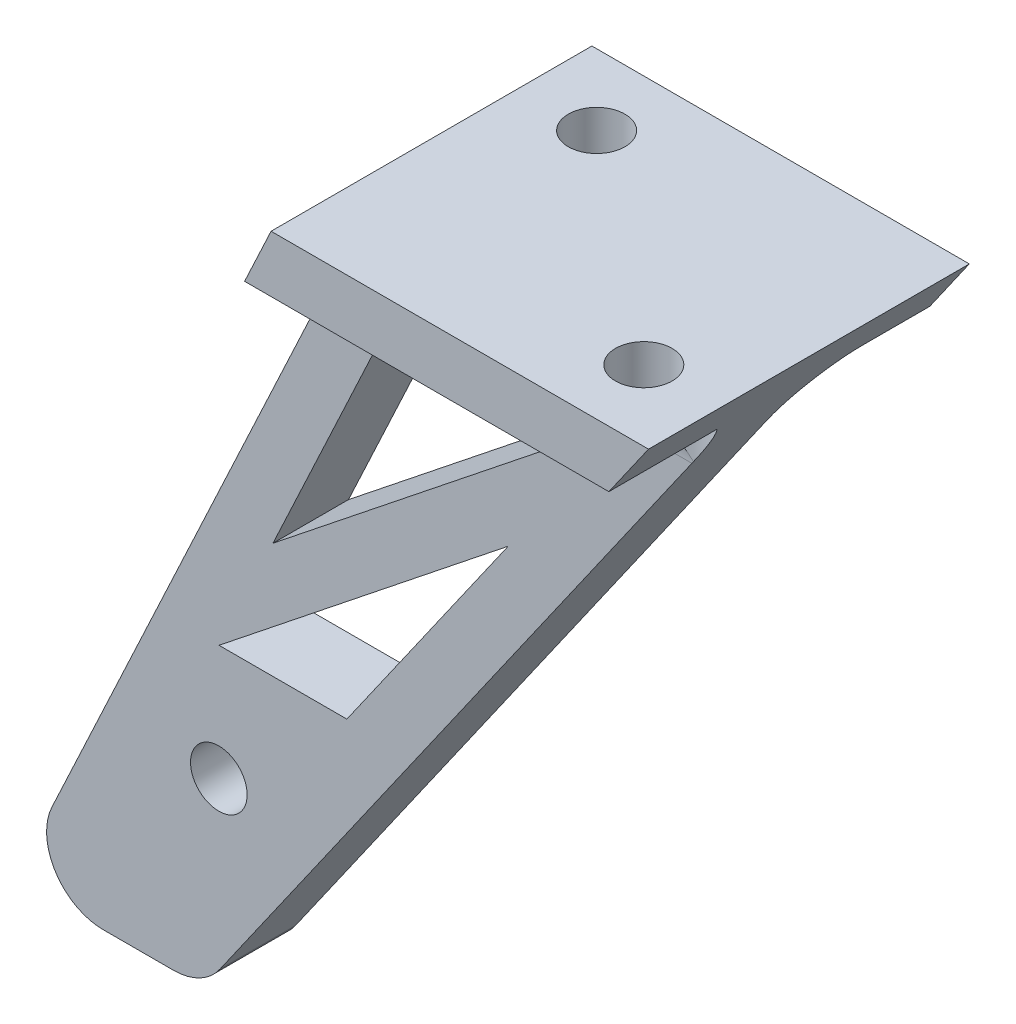
from build123d import *
from build123d.topology import SkipClean

# Parameters (mm, degrees)
BOSS_EXTRUDE1_DEPTH     = 4
SKETCH2_W               = 19.302325582
SKETCH2_H               = 17
BOSS_EXTRUDE2_DEPTH     = 3
CUT_EXTRUDE1_DEPTH      = 52.89534967
CUT_EXTRUDE1_DEPTH_BACK = 52.89534967
BOSS_EXTRUDE3_DEPTH     = 17
FILLET1_R               = 3
CUT_EXTRUDE2_DEPTH      = 50.194156235
CUT_EXTRUDE2_DEPTH_BACK = 50.194156235
SKETCH5_R               = 1.5
CUT_EXTRUDE3_DEPTH      = 52.662994567
CUT_EXTRUDE3_DEPTH_BACK = 52.662994567
SKETCH6_R               = 1.5
FILLET2_R               = 3
SKETCH7_R               = 2.75
CUT_EXTRUDE5_DEPTH      = 50.194156235


with BuildPart() as part:
    # Sketch1 → Boss-Extrude1 (new body)
    with BuildSketch(Plane.XY):
        Polygon((-28.357138738, -40), (-18.357138738, -40), (9.651162791, 0), (-9.651162791, 0), align=None)
    extrude(amount=BOSS_EXTRUDE1_DEPTH)

    # Sketch2 → Boss-Extrude2 (add)
    with BuildSketch(Plane(origin=(0, 0, 0), x_dir=(1, 0, 0), z_dir=(0, 1, 0))):
        with Locations((0, -2)):
            Rectangle(SKETCH2_W, SKETCH2_H)
    extrude(amount=BOSS_EXTRUDE2_DEPTH)

    # Sketch3 → Cut-Extrude1 (cut, two sides: drawn at the far end of the back side and taken through both)
    with BuildSketch(Plane.XY.offset(10.5).offset(-CUT_EXTRUDE1_DEPTH_BACK)):
        Polygon((-9.651162791, 0), (-8.248214595, 3), (-9.651162791, 3), align=None)
    extrude(amount=CUT_EXTRUDE1_DEPTH + CUT_EXTRUDE1_DEPTH_BACK, mode=Mode.SUBTRACT)

    # Sketch4 → Boss-Extrude3 (add, through all)
    with BuildSketch(Plane.XY.offset(10.5)):
        Polygon((9.651162791, 3), (9.651162791, 0), (11.751785405, 3), align=None)
    extrude(amount=-BOSS_EXTRUDE3_DEPTH)

    # Fillet1
    fillet1_edges = [part.edges().sort_by_distance(p)[0] for p in [
        (-18.357138738, -40, 2),
        (-28.357138738, -40, 2),
    ]]
    fillet(fillet1_edges, radius=FILLET1_R)

    # Sketch5 → Cut-Extrude2 (cut, two sides: drawn at the far end of the back side and taken through both)
    with BuildSketch(Plane.XY.offset(4).offset(-CUT_EXTRUDE2_DEPTH_BACK)):
        with Locations((-17.517854053, -30)):
            Circle(SKETCH5_R)
        Polygon((-10.732268808, -23.880216821), (-17.506894929, -23.880216821), (-2.185708769, -11.674464137), align=None)
        Polygon((-14.648109244, -17.767120785), (3.88821641, -3), (-7.742274088, -3), align=None)
    extrude(amount=CUT_EXTRUDE2_DEPTH + CUT_EXTRUDE2_DEPTH_BACK, mode=Mode.SUBTRACT)

    # Sketch6 → Cut-Extrude3 (cut, two sides: drawn at the far end of the back side and taken through both)
    with BuildSketch(Plane(origin=(0, 3, 0), x_dir=(1, 0, 0), z_dir=(0, 1, 0)).offset(-CUT_EXTRUDE3_DEPTH_BACK)):
        with Locations(Location((-4.248214595, 2.75, 0), (0, 0, 180))):
            Circle(SKETCH6_R)
        with Locations(Location((7.751785405, -6.75, 0), (0, 0, 180))):
            Circle(SKETCH6_R)
    extrude(amount=CUT_EXTRUDE3_DEPTH + CUT_EXTRUDE3_DEPTH_BACK, mode=Mode.SUBTRACT)

    # Fillet2
    # the kernel refuses this fillet: 3 mm, written as the material it adds along each edge
    with BuildSketch(Plane(origin=(17.151162791, 0, 0), x_dir=(0, -1, 0), z_dir=(-1, 0, 0))) as fillet2_piece_1_section:
        with BuildLine():
            CenterArc((FILLET2_R, -FILLET2_R), FILLET2_R, 90, 90)
            Line((0, -FILLET2_R), (0, 0))
            Line((0, 0), (FILLET2_R, 0))
        make_face()
    fillet2_piece_1 = extrude(amount=34.302325581, mode=Mode.PRIVATE)
    fillet2_piece_1 = split(fillet2_piece_1, bisect_by=Plane(origin=(8.707650451, -1.347475267, -0.62141613), z_dir=(-0.8191520442889888, 0.5735764363510504, 0)), keep=Keep.TOP, mode=Mode.PRIVATE)
    fillet2_piece_1 = split(fillet2_piece_1, bisect_by=Plane(origin=(-6.80101607, 6.094622871, -0.62141613), z_dir=(0.9058417102512069, -0.42361633109356, 0)), keep=Keep.TOP, mode=Mode.PRIVATE)
    fillet2_piece_1 = fillet2_piece_1 - Plane(origin=(-4.248214595, -0.776972683, -2.75), x_dir=(-1, 0, 0), z_dir=(0, 1, 0)) * Cylinder(1.5, 81, mode=Mode.PRIVATE)
    add(fillet2_piece_1)
    with BuildSketch(Plane(origin=(17.151162791, 0, 4), x_dir=(0, -1, 0), z_dir=(-1, 0, 0))) as fillet2_piece_2_section:
        with BuildLine():
            CenterArc((FILLET2_R, FILLET2_R), FILLET2_R, 180, 90)
            Line((0, FILLET2_R), (0, 0))
            Line((0, 0), (FILLET2_R, 0))
        make_face()
    fillet2_piece_2 = extrude(amount=34.302325581, mode=Mode.PRIVATE)
    fillet2_piece_2 = split(fillet2_piece_2, bisect_by=Plane(origin=(8.664647852, -1.408889344, 4.489642882), z_dir=(-0.8191520442889888, 0.5735764363510504, 0)), keep=Keep.TOP, mode=Mode.PRIVATE)
    fillet2_piece_2 = split(fillet2_piece_2, bisect_by=Plane(origin=(-6.833394213, 6.025386936, 4.489642882), z_dir=(0.9058417102512069, -0.42361633109356, 0)), keep=Keep.TOP, mode=Mode.PRIVATE)
    fillet2_piece_2 = fillet2_piece_2 - Plane(origin=(7.751785405, -0.84697785, 6.75), x_dir=(-1, 0, 0), z_dir=(0, 1, 0)) * Cylinder(1.5, 81, mode=Mode.PRIVATE)
    add(fillet2_piece_2)

    # Sketch7 → Cut-Extrude5 (cut, through all)
    with SkipClean():  # the faces are left unmerged after this step: merging them gives an invalid solid
        with BuildSketch(Plane.XZ):
            with Locations((-4.248214595, -2.75)):
                Circle(SKETCH7_R)
            with Locations((7.751785405, 6.75)):
                Circle(SKETCH7_R)
        extrude(amount=CUT_EXTRUDE5_DEPTH, mode=Mode.SUBTRACT)


solid = part.part
